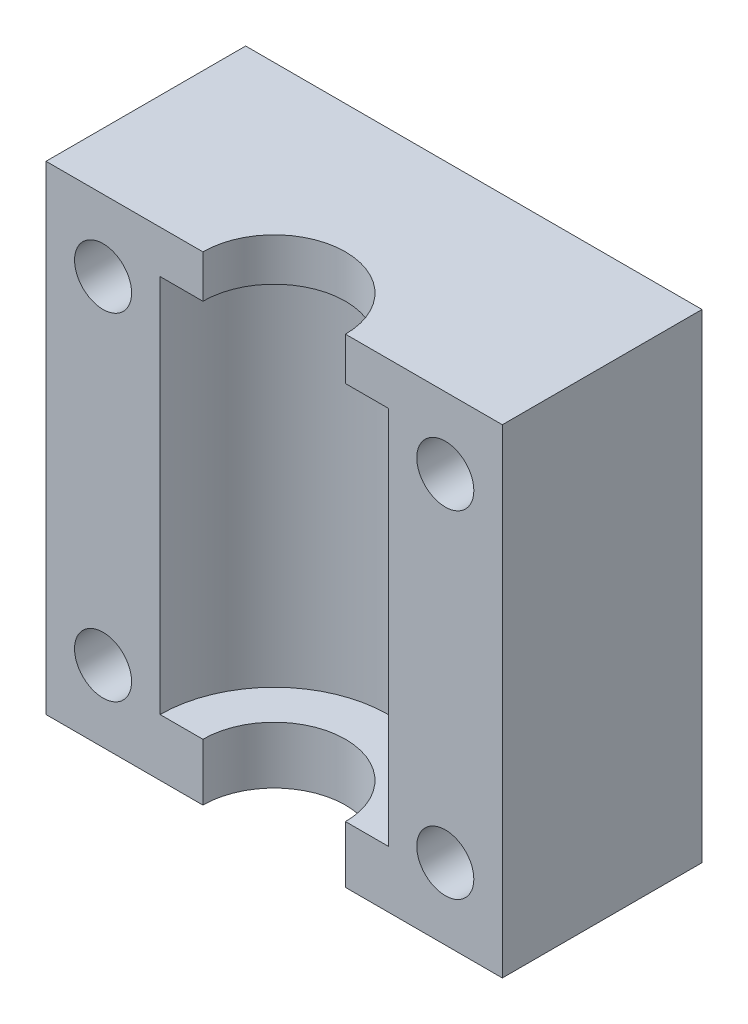
from build123d import *

# Parameters (mm, degrees)
REVOLUCI_N1_ANGLE         = 180
CROQUIS2_W                = 8
CROQUIS2_H                = 33.6
SALIENTE_EXTRUIR1_DEPTH   = 14
SALIENTE_EXTRUIR1_2_DEPTH = 14
SALIENTE_EXTRUIR2_START   = -33.6
SALIENTE_EXTRUIR2_DEPTH   = 33.6
CROQUIS4_R                = 2
CORTAR_EXTRUIR1_DEPTH     = 26


# Read off the part's stored shape, not the designer's step: Saliente-Extruir2
with BuildPart() as part:
    # Croquis1 → Revolución1 (revolve)
    with BuildSketch(Plane.XY):
        Polygon((-8, 0), (-5, 0), (-5, 3), (-14, 3), (-14, -30.6), (-5, -30.6), (-5, -26.6), (-8, -26.6), align=None)
    revolve(axis=Axis((0, 0, 0), (0, -1, 0)), revolution_arc=REVOLUCI_N1_ANGLE)



with BuildPart() as body_2:
    # Croquis2 → Saliente-Extruir1 (new body)
    with BuildSketch(Plane.XY):
        with Locations((-12, -13.8)):
            Rectangle(CROQUIS2_W, CROQUIS2_H)
    extrude(amount=-SALIENTE_EXTRUIR1_DEPTH)


with BuildPart() as body_3:
    # Croquis2 → Saliente-Extruir1 2 (new body)
    with BuildSketch(Plane.XY):
        with Locations((12, -13.8)):
            Rectangle(CROQUIS2_W, CROQUIS2_H)
    extrude(amount=-SALIENTE_EXTRUIR1_2_DEPTH)


with BuildPart() as part_1:
    add(part.part)

    add(body_2.part)  # Saliente-Extruir2 merges body 2

    add(body_3.part)  # Saliente-Extruir2 merges body 3
    # Saliente-Extruir2 outline → Saliente-Extruir2 (add)
    with BuildSketch(Plane(origin=(0, 3, 0), x_dir=(1, 0, 0), z_dir=(0, 1, 0)).offset(SALIENTE_EXTRUIR2_START)):
        with BuildLine():
            Line((8, 14), (0, 14))
            ThreePointArc((0, 14), (4.192388692, 13.357540082), (8, 11.489125293))
            Line((8, 11.489125293), (8, 14))
        make_face()
        with BuildLine():
            Line((0, 14), (-8, 14))
            Line((-8, 14), (-8, 11.489125293))
            ThreePointArc((-8, 11.489125293), (-4.192388692, 13.357540082), (0, 14))
        make_face()
    extrude(amount=SALIENTE_EXTRUIR2_DEPTH)

    # Croquis4 → Cortar-Extruir1 (cut)
    with BuildSketch(Plane.XY):
        with Locations((-12, -2)):
            Circle(CROQUIS4_R)
        with Locations((12, -2)):
            Circle(CROQUIS4_R)
        with Locations((-12, -25.6)):
            Circle(CROQUIS4_R)
        with Locations((12, -25.6)):
            Circle(CROQUIS4_R)
    extrude(amount=-CORTAR_EXTRUIR1_DEPTH, mode=Mode.SUBTRACT)


solid = part_1.part
